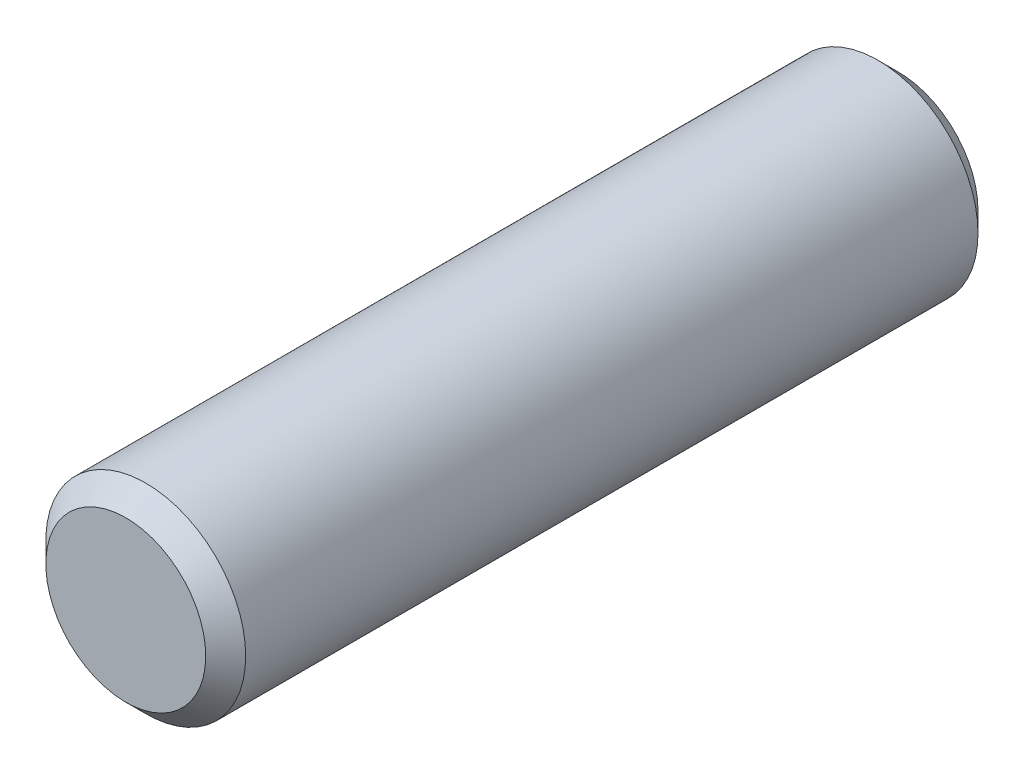
from build123d import *

# Parameters (mm, degrees)
SKETCH3_R           = 7.9375
BOSS_EXTRUDE1_DEPTH = 30.675
CHAMFER1_SIZE       = 1.5875


with BuildPart() as part:
    # Sketch3 → Boss-Extrude1 (new, symmetric)
    with BuildSketch(Plane.XY):
        Circle(SKETCH3_R)
    extrude(amount=BOSS_EXTRUDE1_DEPTH, both=True)

    # Chamfer1
    chamfer1_edges = [part.edges().sort_by_distance(p)[0] for p in [
        (-7.9375, 0, -30.675),
        (-7.9375, 0, 30.675),
    ]]
    chamfer(chamfer1_edges, length=CHAMFER1_SIZE)


solid = part.part
